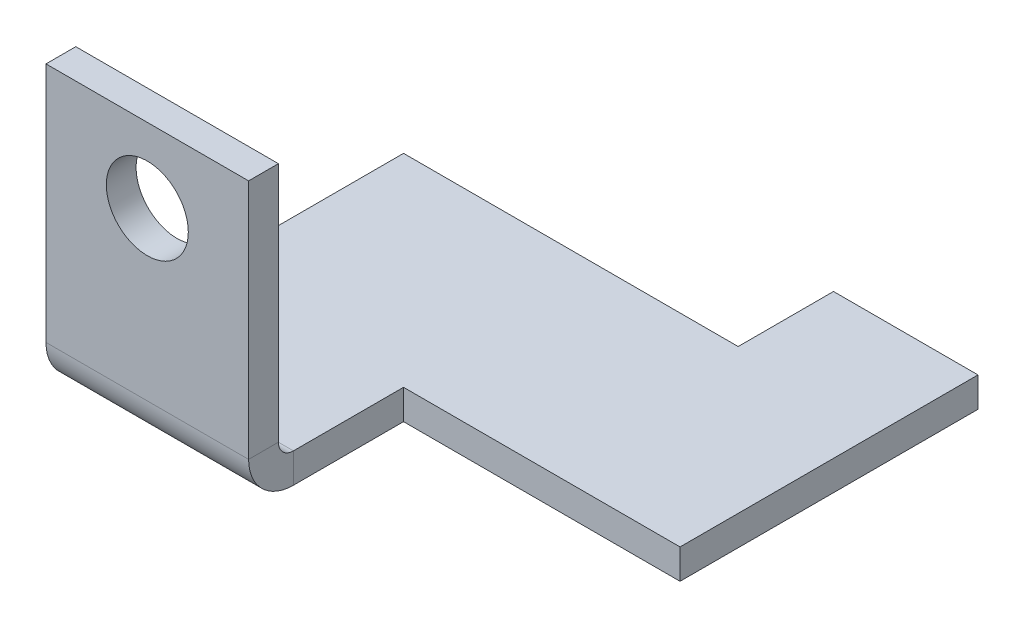
from build123d import *

# Parameters (mm, degrees)
SKETCH1_R                    = 4.3688
BOSS_EXTRUDE1_DEPTH          = 3.175
EDGE_FLANGE1_STRIP_W         = 15.900000204
EDGE_FLANGE1_STRIP_H         = 3.175
EDGE_FLANGE1_STRIP_CUT_DEPTH = 21.59
EDGE_FLANGE1_DEPTH           = 21.59
EDGE_FLANGE1_FLAT_DEPTH      = 3.175


# Sheet-metal steps are written as plain solids
with BuildPart() as part:
    # Sketch1 → Boss-Extrude1 (new body)
    with BuildSketch(Plane.XY):
        Polygon((-10.795, 15.24), (10.795, 15.24), (10.795, -15.24), (-10.795, -15.24), (-10.795, -1.27), align=None)
        with Locations((0, 7.3025)):
            Circle(SKETCH1_R, mode=Mode.SUBTRACT)
    extrude(amount=BOSS_EXTRUDE1_DEPTH)

    # Edge-Flange1 strip (across the edge) → Edge-Flange1 strip cut (cut)
    with BuildSketch(Plane(origin=(10.795, -15.24, 0), x_dir=(0, 1, 0), z_dir=(-1, 0, 0))):
        with Locations((-3.175, -1.5875)):
            Rectangle(EDGE_FLANGE1_STRIP_W, EDGE_FLANGE1_STRIP_H)
    extrude(amount=EDGE_FLANGE1_STRIP_CUT_DEPTH, mode=Mode.SUBTRACT)

    # Edge-Flange1 bend section (across the edge) → Edge-Flange1 (add)
    with BuildSketch(Plane(origin=(10.795, -15.24, 0), x_dir=(0, 1, 0), z_dir=(-1, 0, 0))):
        with BuildLine():
            Line((0, 1.600000102), (3.175, 1.600000102))
            ThreePointArc((3.175, 1.600000102), (3.64362918, 0.46862918), (4.775000102, 0))
            Line((4.775000102, 0), (4.775000102, -3.175))
            ThreePointArc((4.775000102, -3.175), (1.39856515, -1.77643485), (0, 1.600000102))
        make_face()
    extrude(amount=EDGE_FLANGE1_DEPTH)

    # Edge-Flange1 profile (on flange) → Edge-Flange1 flat (add)
    with BuildSketch(Plane(origin=(0, -15.24, 0), x_dir=(1, 0, 0), z_dir=(0, 1, 0))):
        Polygon((-10.795, 1.600000102), (10.795, 1.600000102), (10.795, 13.335), (33.655, 13.335), (38.735, 13.335), (40.259, 13.335), (40.259, 45.085), (38.735, 45.085), (26.386399264, 45.085), (24.862399264, 45.085), (24.862399264, 34.925), (21.306399264, 34.925), (16.226399264, 34.925), (10.795, 34.925), (-10.795, 34.925), (-10.795, 13.335), align=None)
    extrude(amount=EDGE_FLANGE1_FLAT_DEPTH)


solid = part.part
